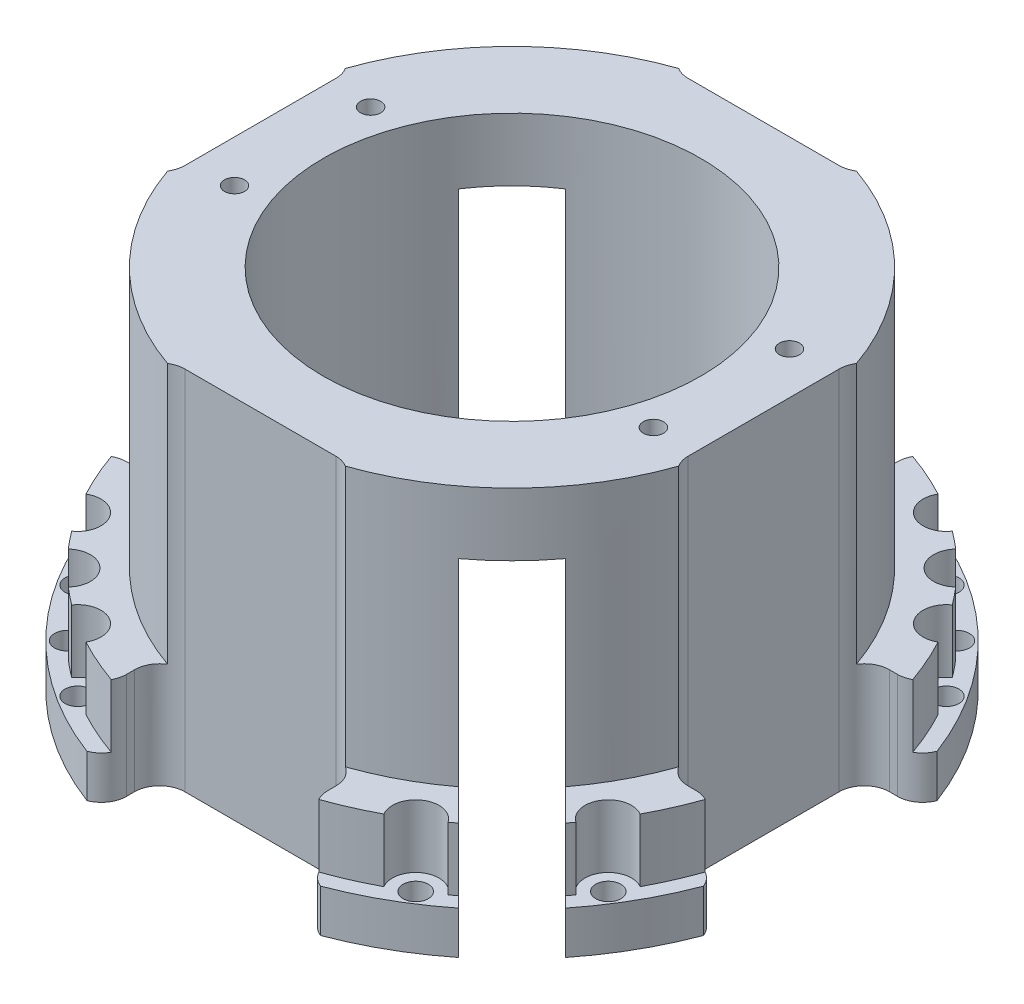
from build123d import *

# Parameters (mm, degrees)
SKETCH1_R                     = 1
BOSS_EXTRUDE1_DEPTH           = 3.4
BOSS_EXTRUDE3_DEPTH           = 5
SKETCH4_R                     = 1.85
CUT_EXTRUDE1_DEPTH            = 5
SKETCH9_R                     = 19
CENTER_HOLE_DEPTH             = 36.651928419
SKETCH2_R                     = 21.5
SKETCH2_R_2                   = 15
BOSS_EXTRUDE2_DEPTH           = 29.1
SKETCH27_R                    = 0.8
TOP_FACE_MOUNTING_HOLES_DEPTH = 46.247209859
CUT_EXTRUDE17_DEPTH           = 43.205568353
CUT_EXTRUDE10_DEPTH           = 41.360748259
CIRPATTERN3_COUNT             = 4
FILLET8_START                 = -1
FILLET8_DEPTH                 = 9.4


with BuildPart() as part:
    # Sketch1 → Boss-Extrude1 (new body)
    with BuildSketch(Plane(origin=(0, 0, 0), x_dir=(1, 0, 0), z_dir=(0, 1, 0))):
        with BuildLine():
            Line((9.283856957, 24.5), (-9.283856957, 24.5))
            ThreePointArc((-9.283856957, 24.5), (-18.526197667, 18.526197667), (-24.5, 9.283856957))
            Line((-24.5, 9.283856957), (-24.5, -9.283856957))
            ThreePointArc((-24.5, -9.283856957), (-18.526197667, -18.526197667), (-9.283856957, -24.5))
            Line((-9.283856957, -24.5), (9.283856957, -24.5))
            ThreePointArc((9.283856957, -24.5), (18.526197667, -18.526197667), (24.5, -9.283856957))
            Line((24.5, -9.283856957), (24.5, 9.283856957))
            ThreePointArc((24.5, 9.283856957), (18.526197667, 18.526197667), (9.283856957, 24.5))
        make_face()
        with Locations(Location((-13.432490209, 21.084786145, 0), (0, 0, 270))):
            Circle(SKETCH1_R, mode=Mode.SUBTRACT)
        with Locations(Location((-17.67766953, 17.67766953, 0), (0, 0, 270))):
            Circle(SKETCH1_R, mode=Mode.SUBTRACT)
        with Locations(Location((-21.084786145, 13.432490209, 0), (0, 0, 90))):
            Circle(SKETCH1_R, mode=Mode.SUBTRACT)
        with Locations(Location((21.084786145, 13.432490209, 0), (0, 0, 270))):
            Circle(SKETCH1_R, mode=Mode.SUBTRACT)
        with Locations(Location((17.67766953, 17.67766953, 0), (0, 0, 270))):
            Circle(SKETCH1_R, mode=Mode.SUBTRACT)
        with Locations(Location((13.432490209, 21.084786145, 0), (0, 0, 90))):
            Circle(SKETCH1_R, mode=Mode.SUBTRACT)
        with Locations(Location((13.432490209, -21.084786145, 0), (0, 0, 270))):
            Circle(SKETCH1_R, mode=Mode.SUBTRACT)
        with Locations(Location((17.67766953, -17.67766953, 0), (0, 0, 270))):
            Circle(SKETCH1_R, mode=Mode.SUBTRACT)
        with Locations(Location((21.084786145, -13.432490209, 0), (0, 0, 90))):
            Circle(SKETCH1_R, mode=Mode.SUBTRACT)
        with Locations(Location((-21.084786145, -13.432490209, 0), (0, 0, 270))):
            Circle(SKETCH1_R, mode=Mode.SUBTRACT)
        with Locations(Location((-17.67766953, -17.67766953, 0), (0, 0, 270))):
            Circle(SKETCH1_R, mode=Mode.SUBTRACT)
        with Locations(Location((-13.432490209, -21.084786145, 0), (0, 0, 90))):
            Circle(SKETCH1_R, mode=Mode.SUBTRACT)
    extrude(amount=BOSS_EXTRUDE1_DEPTH)

    # Sketch3 → Boss-Extrude3 (add)
    with BuildSketch(Plane(origin=(0, 3.4, 0), x_dir=(1, 0, 0), z_dir=(0, 1, 0))):
        with BuildLine():
            Line((-24.5, 4.974937186), (-24.5, -4.974937186))
            ThreePointArc((-24.5, -4.974937186), (-17.67766953, -17.67766953), (-4.974937186, -24.5))
            Line((-4.974937186, -24.5), (4.974937186, -24.5))
            ThreePointArc((4.974937186, -24.5), (17.67766953, -17.67766953), (24.5, -4.974937186))
            Line((24.5, -4.974937186), (24.5, 4.974937186))
            ThreePointArc((24.5, 4.974937186), (17.67766953, 17.67766953), (4.974937186, 24.5))
            Line((4.974937186, 24.5), (-4.974937186, 24.5))
            ThreePointArc((-4.974937186, 24.5), (-17.67766953, 17.67766953), (-24.5, 4.974937186))
        make_face()
    extrude(amount=BOSS_EXTRUDE3_DEPTH)

    # Sketch4 → Cut-Extrude1 (cut)
    with BuildSketch(Plane(origin=(0, 8.4, 0), x_dir=(1, 0, 0), z_dir=(0, 1, 0))):
        with Locations((-17.67766953, 17.67766953)):
            Circle(SKETCH4_R)
        with Locations((-13.432490209, 21.084786145)):
            Circle(SKETCH4_R)
        with Locations((-21.084786145, 13.432490209)):
            Circle(SKETCH4_R)
        with Locations((21.084786145, 13.432490209)):
            Circle(SKETCH4_R)
        with Locations((17.67766953, 17.67766953)):
            Circle(SKETCH4_R)
        with Locations((13.432490209, 21.084786145)):
            Circle(SKETCH4_R)
        with Locations((13.432490209, -21.084786145)):
            Circle(SKETCH4_R)
        with Locations((17.67766953, -17.67766953)):
            Circle(SKETCH4_R)
        with Locations((21.084786145, -13.432490209)):
            Circle(SKETCH4_R)
        with Locations((-21.084786145, -13.432490209)):
            Circle(SKETCH4_R)
        with Locations((-13.432490209, -21.084786145)):
            Circle(SKETCH4_R)
        with Locations((-17.67766953, -17.67766953)):
            Circle(SKETCH4_R)
    extrude(amount=-CUT_EXTRUDE1_DEPTH, mode=Mode.SUBTRACT)

    # Sketch9 → Center Hole (cut, through all)
    with BuildSketch(Plane(origin=(0, 8.4, 0), x_dir=(1, 0, 0), z_dir=(0, 1, 0))):
        with Locations(Location((0, 0, 0), (0, 0, 270))):
            Circle(SKETCH9_R)
    extrude(amount=-CENTER_HOLE_DEPTH, mode=Mode.SUBTRACT)

    # Sketch2 → Boss-Extrude2 (add)
    with BuildSketch(Plane(origin=(0, 29.1, 0), x_dir=(-1, 0, 0), z_dir=(0, 1, 0))):
        with Locations(Location((0, 0, 0), (0, 0, 90))):
            Circle(SKETCH2_R)
        with Locations(Location((0, 0, 0), (0, 0, 90))):
            Circle(SKETCH2_R_2, mode=Mode.SUBTRACT)
    extrude(amount=-BOSS_EXTRUDE2_DEPTH)

    # Sketch27 → Top Face Mounting Holes (cut, through all)
    with BuildSketch(Plane(origin=(0, 29.1, 0), x_dir=(1, 0, 0), z_dir=(0, 1, 0))):
        with Locations(Location((-16.643489035, 5.407797402, 0), (0, 0, 270))):
            Circle(SKETCH27_R)
        with Locations(Location((-16.643489035, -5.407797402, 0), (0, 0, 90))):
            Circle(SKETCH27_R)
        with Locations(Location((16.643489035, -5.407797402, 0), (0, 0, 270))):
            Circle(SKETCH27_R)
        with Locations(Location((16.643489035, 5.407797402, 0), (0, 0, 90))):
            Circle(SKETCH27_R)
    extrude(amount=-TOP_FACE_MOUNTING_HOLES_DEPTH, mode=Mode.SUBTRACT)

    # Sketch28 → Cut-Extrude17 (cut, through all)
    with BuildSketch(Plane(origin=(0, 24.1, 0), x_dir=(1, 0, 0), z_dir=(0, 1, 0))):
        Polygon((-31.516845347, 27.27420466), (27.27420466, -31.516845347), (31.516845347, -27.27420466), (-27.27420466, 31.516845347), align=None)
    extrude(amount=-CUT_EXTRUDE17_DEPTH, mode=Mode.SUBTRACT)

    # Sketch22 → Cut-Extrude10 (cut, symmetric)
    with BuildSketch(Plane(origin=(0, 8.4, 0), x_dir=(1, 0, 0), z_dir=(0, 1, 0))):
        with BuildLine():
            Line((8, 24.5), (-8, 24.5))
            Line((-8, 24.5), (-8, 22))
            ThreePointArc((-8, 22), (-7.414213562, 20.585786438), (-6, 20))
            Line((-6, 20), (6, 20))
            ThreePointArc((6, 20), (7.414213562, 20.585786438), (8, 22))
            Line((8, 22), (8, 24.5))
        make_face()
    cut_extrude10 = extrude(amount=CUT_EXTRUDE10_DEPTH, both=True, mode=Mode.SUBTRACT)

    # CirPattern3: Cut-Extrude10 ×4 about axis
    cirpattern3_axis = Axis((0, 0, 0), (0, 1, 0))
    for i in range(1, CIRPATTERN3_COUNT):
        add(cut_extrude10.rotate(cirpattern3_axis, i * 360 / CIRPATTERN3_COUNT), mode=Mode.SUBTRACT)

    # Fillet8: read off the stored shape, not the designer's step
    # Fillet8 outline → Fillet8 (cut)
    with BuildSketch(Plane(origin=(0, 0, 0), x_dir=(1, 0, 0), z_dir=(0, 1, 0)).offset(FILLET8_START)):
        with BuildLine():
            Line((24.5, 8), (24.5, 9.283856957))
            ThreePointArc((24.5, 9.283856957), (23.765685797, 8.351927476), (22.632611679, 8))
            Line((22.632611679, 8), (24.5, 8))
        make_face()
        with BuildLine():
            Line((24.5, -8), (22.632611679, -8))
            ThreePointArc((22.632611679, -8), (23.765685797, -8.351927476), (24.5, -9.283856957))
            Line((24.5, -9.283856957), (24.5, -8))
        make_face()
        with BuildLine():
            Line((8, -24.5), (9.283856957, -24.5))
            ThreePointArc((9.283856957, -24.5), (8.351927476, -23.765685797), (8, -22.632611679))
            Line((8, -22.632611679), (8, -24.5))
        make_face()
        with BuildLine():
            Line((-8, -24.5), (-8, -22.632611679))
            ThreePointArc((-8, -22.632611679), (-8.351927476, -23.765685797), (-9.283856957, -24.5))
            Line((-9.283856957, -24.5), (-8, -24.5))
        make_face()
        with BuildLine():
            Line((-24.5, -8), (-24.5, -9.283856957))
            ThreePointArc((-24.5, -9.283856957), (-23.765685797, -8.351927476), (-22.632611679, -8))
            Line((-22.632611679, -8), (-24.5, -8))
        make_face()
        with BuildLine():
            Line((-24.5, 8), (-22.632611679, 8))
            ThreePointArc((-22.632611679, 8), (-23.765685797, 8.351927476), (-24.5, 9.283856957))
            Line((-24.5, 9.283856957), (-24.5, 8))
        make_face()
        with BuildLine():
            Line((8, 24.5), (8, 22.632611679))
            ThreePointArc((8, 22.632611679), (8.351927476, 23.765685797), (9.283856957, 24.5))
            Line((9.283856957, 24.5), (8, 24.5))
        make_face()
        with BuildLine():
            Line((-8, 24.5), (-9.283856957, 24.5))
            ThreePointArc((-9.283856957, 24.5), (-8.351927476, 23.765685797), (-8, 22.632611679))
            Line((-8, 22.632611679), (-8, 24.5))
        make_face()
    extrude(amount=FILLET8_DEPTH, mode=Mode.SUBTRACT)


solid = part.part
